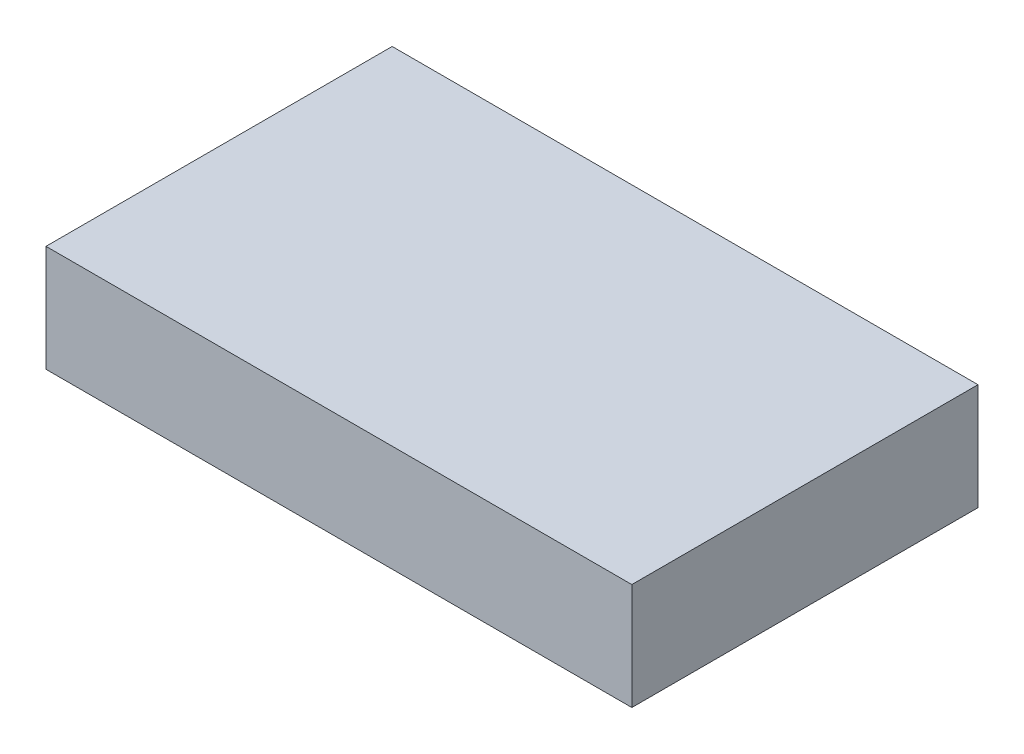
from build123d import *

# Parameters (mm, degrees)
SKETCH1_W           = 22
SKETCH1_H           = 13
BOSS_EXTRUDE1_DEPTH = 2


with BuildPart() as part:
    # Sketch1 → Boss-Extrude1 (new, symmetric)
    with BuildSketch(Plane(origin=(0, 0, 0), x_dir=(1, 0, 0), z_dir=(0, 1, 0))):
        Rectangle(SKETCH1_W, SKETCH1_H)
    extrude(amount=BOSS_EXTRUDE1_DEPTH, both=True)


solid = part.part
